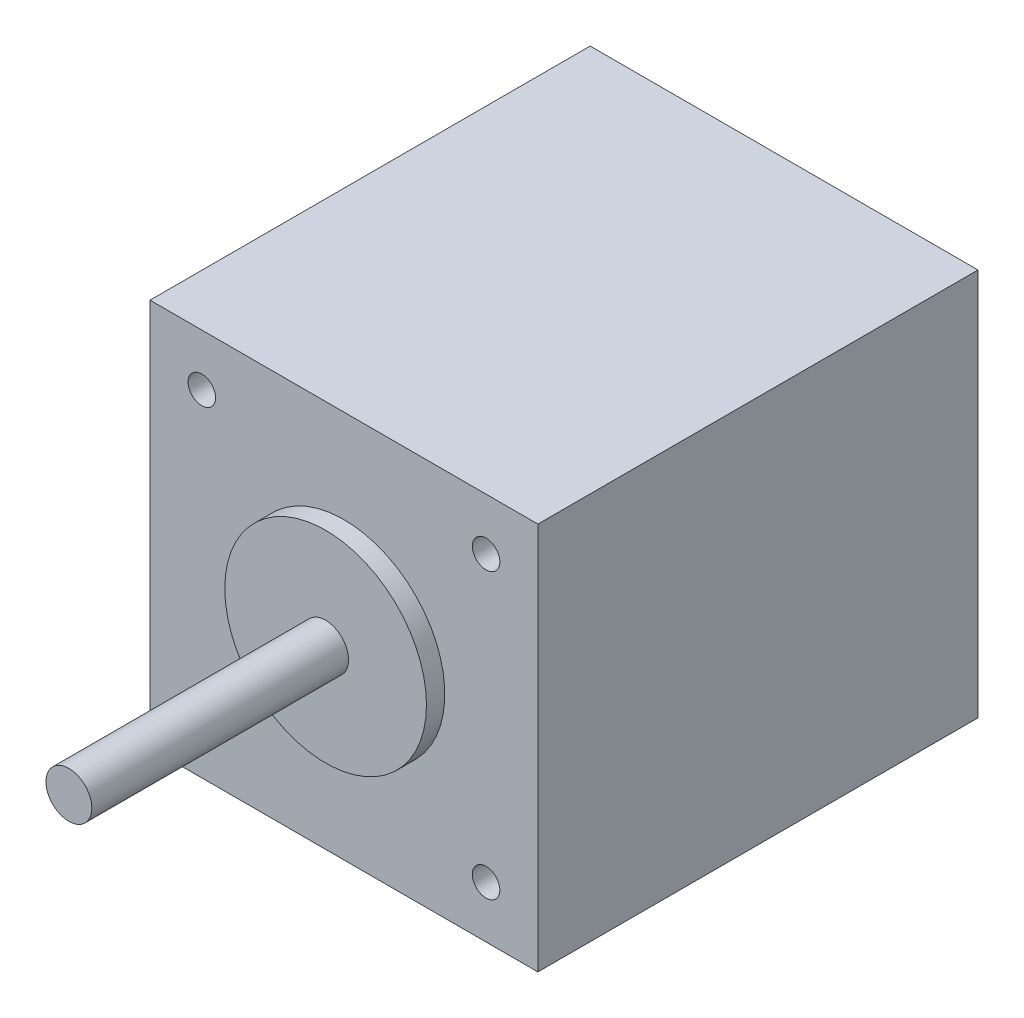
from build123d import *

# Parameters (mm, degrees)
SKETCH_1_W          = 42.3
SKETCH_1_H          = 42.3
EXTRUDE_1224_DEPTH  = 48
SKETCH_2_R          = 2.5
EXTRUDE_1279_DEPTH  = 78
SKETCH_3_R          = 11
EXTRUDE_1326_DEPTH  = 50
CUT_EXTRUDE_START   = 48
SKETCH_5_R          = 1.5
CUT_EXTRUDE_3_DEPTH = 4.5


with BuildPart() as part:
    # Эскиз1 → Extrude 1224 (new body)
    with BuildSketch(Plane.XY):
        Rectangle(SKETCH_1_W, SKETCH_1_H)
    extrude(amount=EXTRUDE_1224_DEPTH)

    # Эскиз2 → Extrude 1279 (add)
    with BuildSketch(Plane.XY):
        Circle(SKETCH_2_R)
    extrude(amount=EXTRUDE_1279_DEPTH)

    # Эскиз3 → Extrude 1326 (add)
    with BuildSketch(Plane.XY):
        Circle(SKETCH_3_R)
    extrude(amount=EXTRUDE_1326_DEPTH)

    # Эскиз5 → Крепеж_М3_ПРЕДВ (cut)
    with BuildSketch(Plane.XY.offset(CUT_EXTRUDE_START)):
        with Locations((-15.5, -15.5)):
            Circle(SKETCH_5_R)
        with Locations((-15.5, 15.5)):
            Circle(SKETCH_5_R)
        with Locations((15.5, -15.5)):
            Circle(SKETCH_5_R)
        with Locations((15.5, 15.5)):
            Circle(SKETCH_5_R)
    extrude(amount=-CUT_EXTRUDE_3_DEPTH, mode=Mode.SUBTRACT)


solid = part.part
